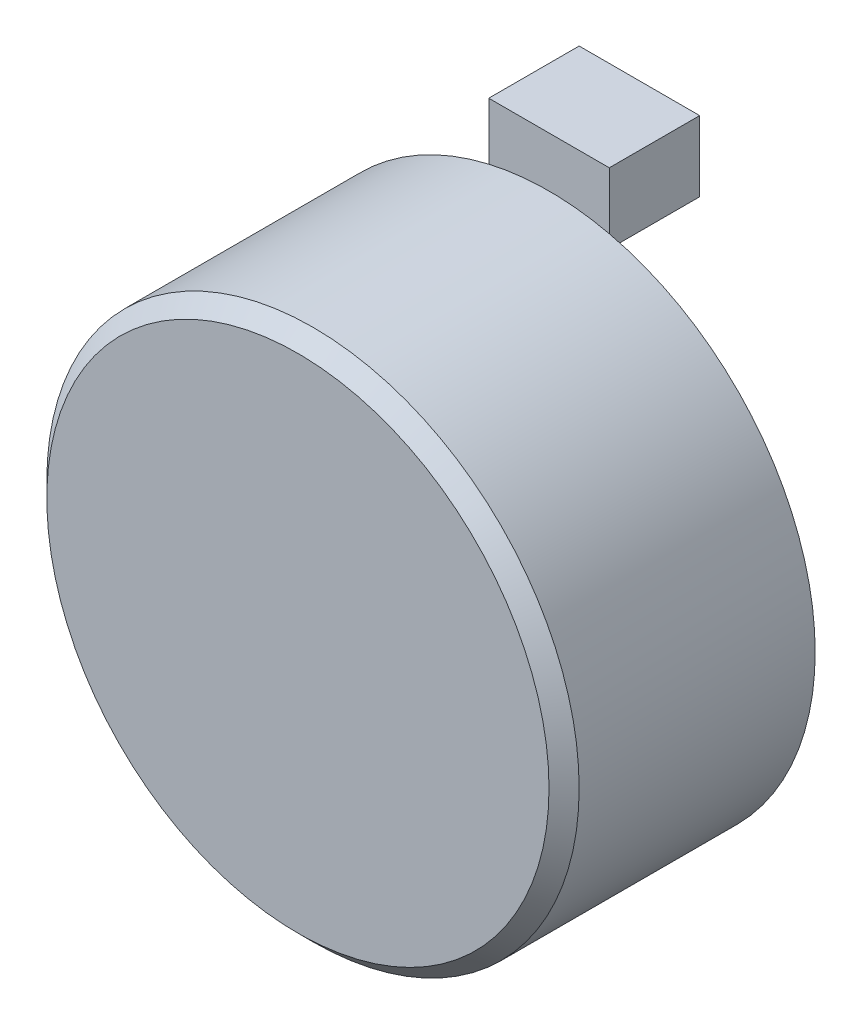
from build123d import *

# Parameters (mm, degrees)
SK_REARHOLE_R           = 1.65
REAR_TAPPED_HOLE_DEPTH  = 8
REAR_HOLE_PATTERN_COUNT = 8
SK_CONNECTOR_W          = 24
SK_CONNECTOR_H          = 14
CONNECTOR_ZONE_DEPTH    = 18


with BuildPart() as part:
    # SK_Body → Housing_Body (revolve)
    with BuildSketch(Plane(origin=(0, 0, 0), x_dir=(1, 0, 0), z_dir=(0, 1, 0))):
        Polygon((0, 0), (50, 0), (53, 3), (53, 50), (50, 50), (0, 50), align=None)
    revolve(axis=Axis((0, 0, 10), (0, 0, -1)))

    # SK_RearHole → Rear_Tapped_Hole (cut)
    with BuildSketch(Plane.XY.offset(-50)):
        with Locations((45, 0)):
            Circle(SK_REARHOLE_R)
    rear_tapped_hole = extrude(amount=REAR_TAPPED_HOLE_DEPTH, mode=Mode.SUBTRACT)

    # Rear_Hole_Pattern: Rear_Tapped_Hole ×8 about axis
    rear_hole_pattern_axis = Axis((0, 0, -71.4), (0, 0, 1))
    for i in range(1, REAR_HOLE_PATTERN_COUNT):
        add(rear_tapped_hole.rotate(rear_hole_pattern_axis, i * 360 / REAR_HOLE_PATTERN_COUNT), mode=Mode.SUBTRACT)

    # SK_Connector → Connector_Zone (add)
    with BuildSketch(Plane.XY.offset(-50)):
        with Locations((0, 56)):
            Rectangle(SK_CONNECTOR_W, SK_CONNECTOR_H)
    extrude(amount=-CONNECTOR_ZONE_DEPTH)


solid = part.part
